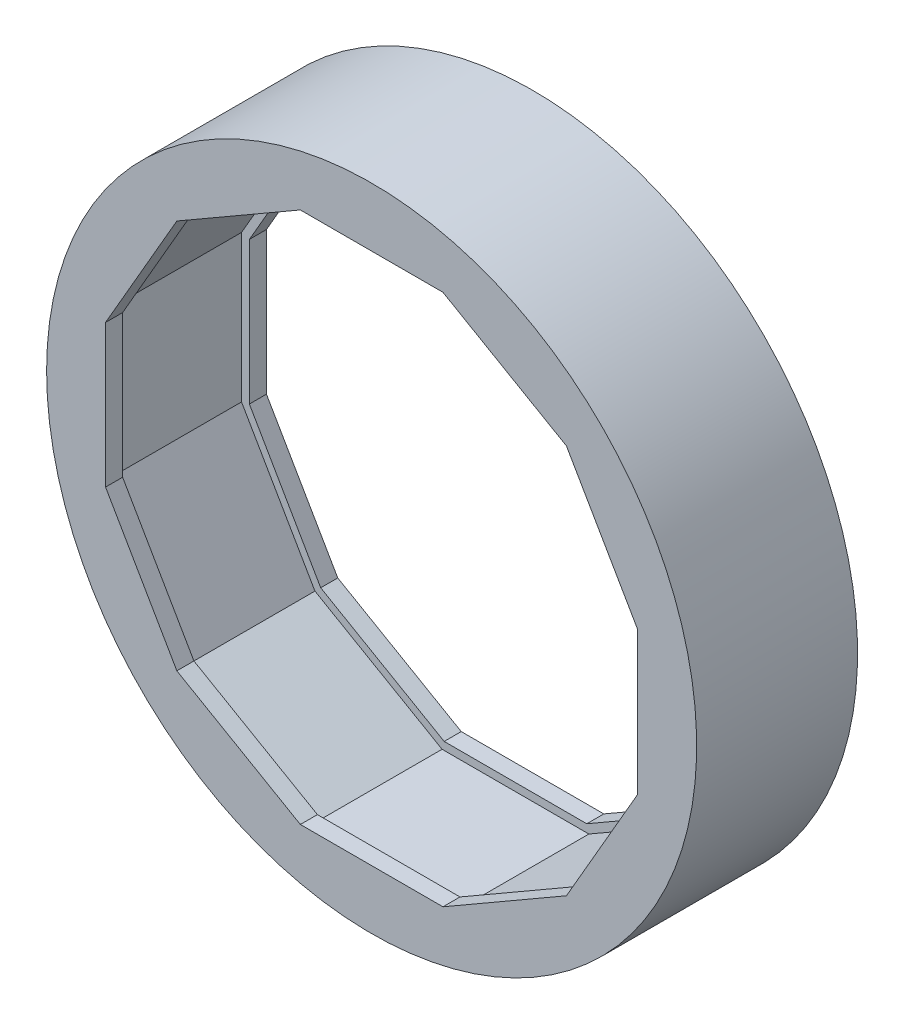
from build123d import *

# Parameters (mm, degrees)
S01_80_MM_TYRE_AND_TWO_INWARD_BEAD_LIP_R       = 40
F_01_80_MM_TYRE_AND_TWO_INWARD_BEAD_LIPS_DEPTH = 19.8
F_02_START                                     = 2.1
F_02_CENTRAL_KEYED_DRIVE_RECESS_BETWEEN_DEPTH  = 15.6


with BuildPart() as part:
    # S01 - 80 mm tyre and two inward bead lips → 01 - 80 mm tyre and two inward bead lips (new body)
    with BuildSketch(Plane.XY):
        Circle(S01_80_MM_TYRE_AND_TWO_INWARD_BEAD_LIP_R)
        Polygon((32.744885511, 8.773965629), (23.970919882, 23.970919882), (8.773965629, 32.744885511), (-8.773965629, 32.744885511), (-23.970919882, 23.970919882), (-32.744885511, 8.773965629), (-32.744885511, -8.773965629), (-23.970919882, -23.970919882), (-8.773965629, -32.744885511), (8.773965629, -32.744885511), (23.970919882, -23.970919882), (32.744885511, -8.773965629), align=None, mode=Mode.SUBTRACT)
    extrude(amount=F_01_80_MM_TYRE_AND_TWO_INWARD_BEAD_LIPS_DEPTH)

    # S02 - Central keyed drive recess between end beads → 02 - Central keyed drive recess between end beads (cut)
    with BuildSketch(Plane.XY.offset(F_02_START)):
        Polygon((33.710811337, 9.032784674), (24.678026663, 24.678026663), (9.032784674, 33.710811337), (-9.032784674, 33.710811337), (-24.678026663, 24.678026663), (-33.710811337, 9.032784674), (-33.710811337, -9.032784674), (-24.678026663, -24.678026663), (-9.032784674, -33.710811337), (9.032784674, -33.710811337), (24.678026663, -24.678026663), (33.710811337, -9.032784674), align=None)
    extrude(amount=F_02_CENTRAL_KEYED_DRIVE_RECESS_BETWEEN_DEPTH, mode=Mode.SUBTRACT)


solid = part.part
